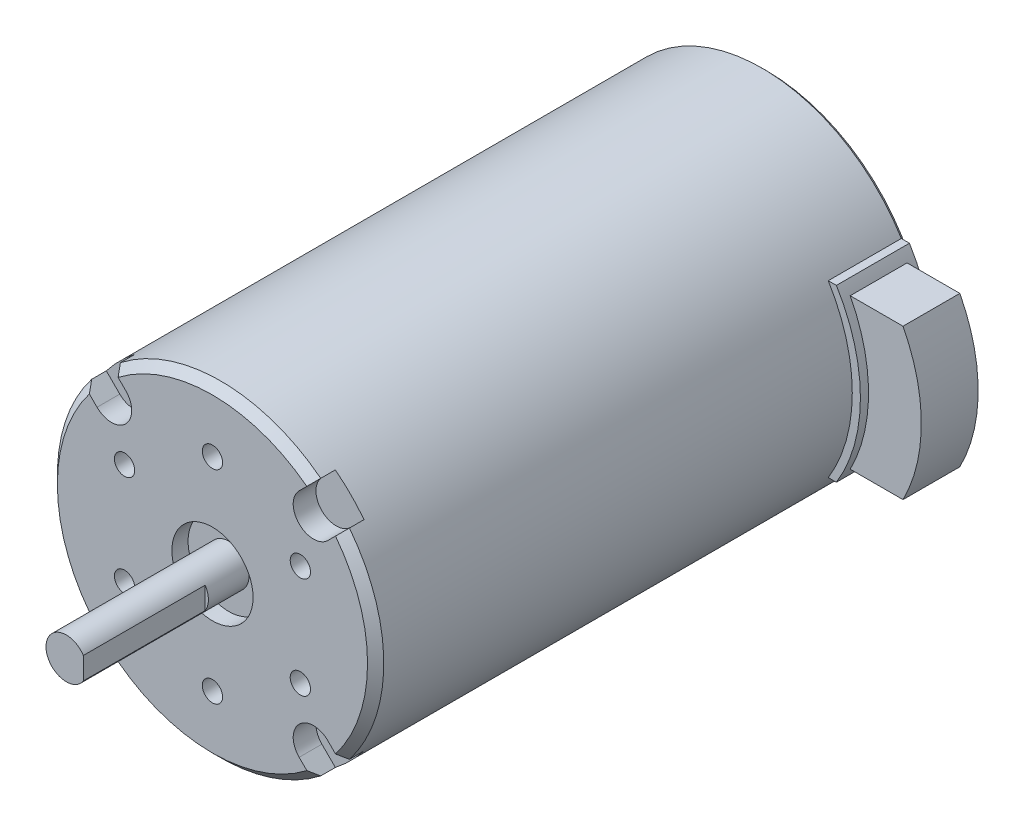
from build123d import *

# Parameters (mm, degrees)
SKETCH_1_R             = 20.1
EXTRUDE_1_DEPTH        = 68.2
SKETCH_2_R             = 5
CUT_EXTRUDE_1_DEPTH    = 2
SKETCH_3_R             = 2.5
EXTRUDE_2_DEPTH        = 20
CUT_EXTRUDE_START      = -15
CUT_EXTRUDE_2_DEPTH    = 15
CHAMFER_1_SIZE         = 1
M3X0_51_D              = 2.5
M3X0_51_DEPTH          = 8.5
M3X0_51_TIP            = 0.751075774
CUT_EXTRUDE_START_2    = -2.8
CUT_EXTRUDE_3_DEPTH    = 2.8
CHAMFER_2_SIZE         = 0.5
EXTRUDE_5_REACH        = 104.708
EXTRUDE_5_START_RADIUS = 20.1
EXTRUDE_5_END_RADIUS   = 20.1
SKETCH_9_W             = 9
SKETCH_9_H             = 21
EXTRUDE_6_REACH        = 110.208
EXTRUDE_6_START_RADIUS = 20.1
EXTRUDE_6_END_RADIUS   = 20.1
SKETCH_10_W            = 7
SKETCH_10_H            = 18.5


with BuildPart() as part:
    # Эскиз1 → Бобышка-Вытянуть1 (new body)
    with BuildSketch(Plane.XY):
        Circle(SKETCH_1_R)
    extrude(amount=EXTRUDE_1_DEPTH)

    # Эскиз2 → Вырез-Вытянуть1 (cut)
    with BuildSketch(Plane.XY.offset(68.2)):
        Circle(SKETCH_2_R)
    extrude(amount=-CUT_EXTRUDE_1_DEPTH, mode=Mode.SUBTRACT)

    # Эскиз3 → Бобышка-Вытянуть2 (add)
    with BuildSketch(Plane.XY.offset(66.2)):
        Circle(SKETCH_3_R)
    extrude(amount=EXTRUDE_2_DEPTH)

    # Эскиз4 → Вырез-Вытянуть2 (cut)
    with BuildSketch(Plane.XY.offset(86.2).offset(CUT_EXTRUDE_START)):
        with BuildLine():
            Line((2.1, 1.356465997), (2.1, -1.356465997))
            ThreePointArc((2.1, -1.356465997), (2.5, 0), (2.1, 1.356465997))
        make_face()
    extrude(amount=CUT_EXTRUDE_2_DEPTH, mode=Mode.SUBTRACT)

    # Фаска1
    chamfer_1_edges = [part.edges().sort_by_distance(p)[0] for p in [
        (-20.1, 0, 68.2),
    ]]
    chamfer(chamfer_1_edges, length=CHAMFER_1_SIZE)

    # Отверстие обработанное метчиком M3x0.51
    with Locations(Plane.XY.offset(68.2)):
        with Locations((-10.825317547, 6.25), (0, 12.5), (10.825317547, 6.25), (10.825317547, -6.25), (0, -12.5), (-10.825317547, -6.25)):
            Hole(M3X0_51_D / 2, depth=M3X0_51_DEPTH)
            with Locations((0, 0, -(M3X0_51_DEPTH + M3X0_51_TIP / 2))):  # 118° drill point
                Cone(0, M3X0_51_D / 2, M3X0_51_TIP, mode=Mode.SUBTRACT)

    # Эскиз8 → Вырез-Вытянуть3 (cut)
    with BuildSketch(Plane.XY.offset(68.2).offset(CUT_EXTRUDE_START_2)):
        with BuildLine():
            Line((-14.212846302, 10.677312396), (-15.870249004, 12.334715098))
            ThreePointArc((-15.870249004, 12.334715098), (-14.212846302, 14.212846302), (-12.334715098, 15.870249004))
            Line((-12.334715098, 15.870249004), (-10.677312396, 14.212846302))
            ThreePointArc((-10.677312396, 14.212846302), (-10.677312396, 10.677312396), (-14.212846302, 10.677312396))
        make_face()
        with BuildLine():
            Line((14.212846302, 10.677312396), (15.870249004, 12.334715098))
            ThreePointArc((15.870249004, 12.334715098), (14.212846302, 14.212846302), (12.334715098, 15.870249004))
            Line((12.334715098, 15.870249004), (10.677312396, 14.212846302))
            ThreePointArc((10.677312396, 14.212846302), (10.677312396, 10.677312396), (14.212846302, 10.677312396))
        make_face()
        with BuildLine():
            Line((10.677312396, -14.212846302), (12.334715098, -15.870249004))
            ThreePointArc((12.334715098, -15.870249004), (14.212846302, -14.212846302), (15.870249004, -12.334715098))
            Line((15.870249004, -12.334715098), (14.212846302, -10.677312396))
            ThreePointArc((14.212846302, -10.677312396), (10.677312396, -10.677312396), (10.677312396, -14.212846302))
        make_face()
        with BuildLine():
            Line((-14.212846302, -10.677312396), (-15.870249004, -12.334715098))
            ThreePointArc((-15.870249004, -12.334715098), (-14.212846302, -14.212846302), (-12.334715098, -15.870249004))
            Line((-12.334715098, -15.870249004), (-10.677312396, -14.212846302))
            ThreePointArc((-10.677312396, -14.212846302), (-10.677312396, -10.677312396), (-14.212846302, -10.677312396))
        make_face()
    extrude(amount=CUT_EXTRUDE_3_DEPTH, mode=Mode.SUBTRACT)

    # Фаска2
    chamfer_2_edges = [part.edges().sort_by_distance(p)[0] for p in [
        (-20.1, 0, 0),
    ]]
    chamfer(chamfer_2_edges, length=CHAMFER_2_SIZE)

    # Бобышка-Вытянуть5: from a cylinder face, 104.708 long prism both ways, kept between that surface and its translate by the depth
    extrude_5_start = Plane(origin=(0, 0, 5), z_dir=(0, 0, -1)) * Cylinder(EXTRUDE_5_START_RADIUS, 250.616, mode=Mode.PRIVATE)
    extrude_5_end = Plane(origin=(1, 0, 5), z_dir=(0, 0, -1)) * Cylinder(EXTRUDE_5_END_RADIUS, 250.616, mode=Mode.PRIVATE)
    # Эскиз9 → Бобышка-Вытянуть5 (add, from a surface)
    with BuildSketch(Plane(origin=(30, 0, 0), x_dir=(0, 0, -1), z_dir=(1, 0, 0)), mode=Mode.PRIVATE) as extrude_5_sk1:
        with Locations((-5, 0)):
            Rectangle(SKETCH_9_W, SKETCH_9_H)
    extrude_5_tool1 = extrude(extrude_5_sk1.sketch, amount=EXTRUDE_5_REACH, both=True, mode=Mode.PRIVATE)
    add(((extrude_5_tool1 - extrude_5_start) & extrude_5_end).solids().sort_by_distance((20.1, 0, 0.5))[0])

    # Бобышка-Вытянуть6: from a cylinder face, 110.208 long prism both ways, kept between that surface and its translate by the depth
    extrude_6_start = Plane(origin=(1, 0, 5), z_dir=(0, 0, -1)) * Cylinder(EXTRUDE_6_START_RADIUS, 261.616, mode=Mode.PRIVATE)
    extrude_6_end = Plane(origin=(7.5, 0, 5), z_dir=(0, 0, -1)) * Cylinder(EXTRUDE_6_END_RADIUS, 261.616, mode=Mode.PRIVATE)
    # Эскиз10 → Бобышка-Вытянуть6 (add, from a surface)
    with BuildSketch(Plane(origin=(30, 0, 0), x_dir=(0, 0, -1), z_dir=(1, 0, 0)), mode=Mode.PRIVATE) as extrude_6_sk1:
        with Locations((-5, 0)):
            Rectangle(SKETCH_10_W, SKETCH_10_H)
    extrude_6_tool1 = extrude(extrude_6_sk1.sketch, amount=EXTRUDE_6_REACH, both=True, mode=Mode.PRIVATE)
    add(((extrude_6_tool1 - extrude_6_start) & extrude_6_end).solids().sort_by_distance((19.619714, 0, 5))[0])


solid = part.part
